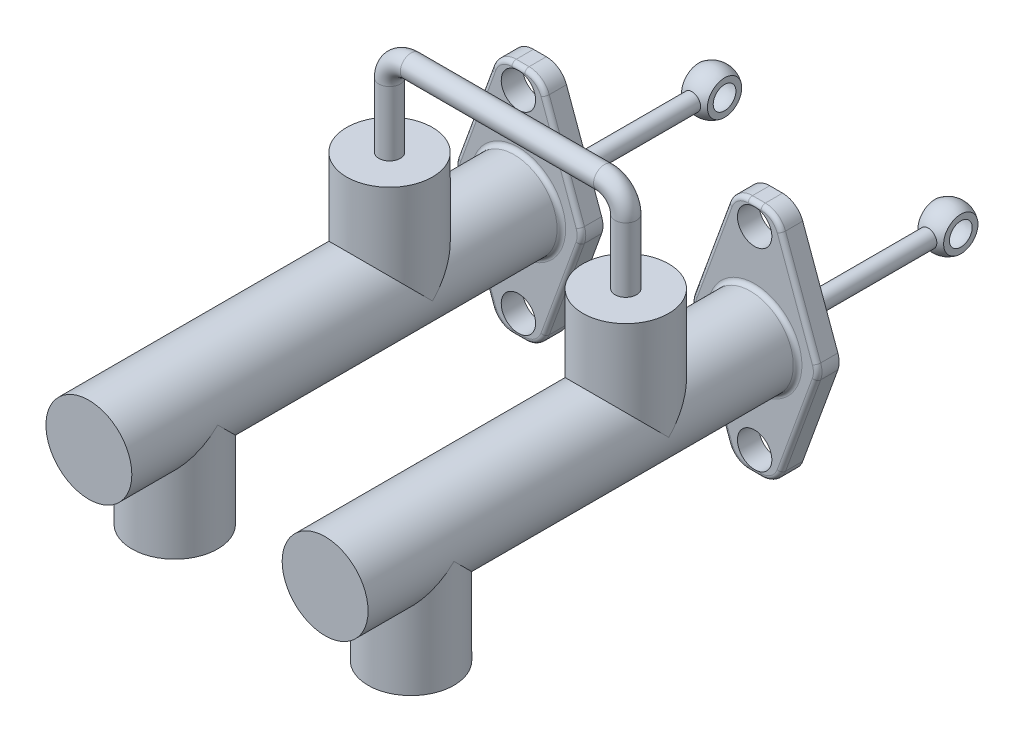
from build123d import *

# Parameters (mm, degrees)
SZKIC1_R                          = 10
DODANIE_WYCI_GNI_CIE1_DEPTH       = 50
DODANIE_WYCI_GNI_CIE1_2_DEPTH     = 50
SZKIC2_R                          = 4
DODANIE_WYCI_GNI_CIE2_DEPTH       = 5
ZAOKR_GLENIE1_R                   = 5
ZAOKR_GLENIE2_R                   = 5
ZAOKR_GLENIE3_R                   = 1
ZAOKR_GLENIE4_R                   = 1
SZKIC5_W                          = 12
SZKIC5_H                          = 25
SZKIC5_W_2                        = 6
SZKIC5_H_2                        = 20
WYTNIJ_WYCI_GNI_CIE1_DEPTH        = 50
SZKIC6_R                          = 10
DODANIE_WYCI_GNI_CIE3_DEPTH       = 25
WYCI_GNI_CIE_PO_CIE_CE1_PROFILE_R = 2.5
SZKIC19_R                         = 10
SZKIC19_R_2                       = 6
DODANIE_WYCI_GNI_CIE4_DEPTH       = 25


with BuildPart() as part:
    # Szkic1 → Dodanie-wyciągnięcie1 (new, symmetric)
    with BuildSketch(Plane.XY):
        with Locations((-27.5, 0)):
            Circle(SZKIC1_R)
    extrude(amount=DODANIE_WYCI_GNI_CIE1_DEPTH, both=True)



with BuildPart() as body_2:
    # Szkic1 → Dodanie-wyci_gni_cie1 2 (new, symmetric)
    with BuildSketch(Plane.XY):
        with Locations((27.5, 0)):
            Circle(SZKIC1_R)
    extrude(amount=DODANIE_WYCI_GNI_CIE1_2_DEPTH, both=True)


with BuildPart() as part_1:
    add(part.part)

    add(body_2.part)  # Dodanie-wyciągnięcie2 merges body 2
    # Szkic2 → Dodanie-wyciągnięcie2 (add)
    # profile 1 of 2: a face of its own
    with BuildSketch(Plane(origin=(0, 0, -50), x_dir=(-1, 0, 0), z_dir=(0, 0, -1))):
        Polygon((-22.5, 27.5), (-32.5, 27.5), (-42.5, 0), (-32.5, -27.5), (-22.5, -27.5), (-12.5, 0), align=None)
        with Locations((-27.5, 22.5)):
            Circle(SZKIC2_R, mode=Mode.SUBTRACT)
        with Locations((-27.5, -22.5)):
            Circle(SZKIC2_R, mode=Mode.SUBTRACT)
    # profile 2 of 2: a face of its own
    with BuildSketch(Plane(origin=(0, 0, -50), x_dir=(-1, 0, 0), z_dir=(0, 0, -1))):
        Polygon((12.5, 0), (22.5, 27.5), (32.5, 27.5), (42.5, 0), (32.5, -27.5), (22.5, -27.5), align=None)
        with Locations(Location((27.5, -22.5, 0), (0, 0, 180))):
            Circle(SZKIC2_R, mode=Mode.SUBTRACT)
        with Locations(Location((27.5, 22.5, 0), (0, 0, 180))):
            Circle(SZKIC2_R, mode=Mode.SUBTRACT)
    extrude(amount=DODANIE_WYCI_GNI_CIE2_DEPTH)

    # Zaokrąglenie1
    zaokr_glenie1_edges = [part_1.edges().sort_by_distance(p)[0] for p in [
        (-22.5, 27.5, -52.5),
        (-12.5, 0, -52.5),
        (-22.5, -27.5, -52.5),
        (-32.5, -27.5, -52.5),
        (-42.5, 0, -52.5),
        (-32.5, 27.5, -52.5),
    ]]
    fillet(zaokr_glenie1_edges, radius=ZAOKR_GLENIE1_R)

    # Zaokrąglenie2
    zaokr_glenie2_edges = [part_1.edges().sort_by_distance(p)[0] for p in [
        (22.5, -27.5, -52.5),
        (12.5, 0, -52.5),
        (22.5, 27.5, -52.5),
        (32.5, 27.5, -52.5),
        (42.5, 0, -52.5),
        (32.5, -27.5, -52.5),
    ]]
    fillet(zaokr_glenie2_edges, radius=ZAOKR_GLENIE2_R)

    # Zaokrąglenie3
    zaokr_glenie3_edges = [part_1.edges().sort_by_distance(p)[0] for p in [
        (-17.212260115, 12.958715315, -50),
        (-17.212260115, -12.958715315, -50),
        (-27.5, 27.5, -50),
        (-37.787739885, 12.958715315, -50),
        (-37.787739885, -12.958715315, -50),
        (-27.5, -27.5, -50),
        (-31.866349638, 26.595337384, -50),
        (-42.179681859, 0, -50),
        (-31.866349638, -26.595337384, -50),
        (-23.133650362, -26.595337384, -50),
        (-12.820318141, 0, -50),
        (-23.133650362, 26.595337384, -50),
        (-37.5, 0, -50),
    ]]
    fillet(zaokr_glenie3_edges, radius=ZAOKR_GLENIE3_R - 0.0001)  # a hair under: the kernel refuses the full size

    # Zaokrąglenie4
    zaokr_glenie4_edges = [part_1.edges().sort_by_distance(p)[0] for p in [
        (17.212260115, 12.958715315, -50),
        (17.212260115, -12.958715315, -50),
        (27.5, -27.5, -50),
        (37.787739885, -12.958715315, -50),
        (37.787739885, 12.958715315, -50),
        (27.5, 27.5, -50),
        (23.133650362, 26.595337384, -50),
        (31.866349638, 26.595337384, -50),
        (42.179681859, 0, -50),
        (31.866349638, -26.595337384, -50),
        (23.133650362, -26.595337384, -50),
        (12.820318141, 0, -50),
        (17.5, 0, -50),
    ]]
    fillet(zaokr_glenie4_edges, radius=ZAOKR_GLENIE4_R - 0.0001)  # a hair under: the kernel refuses the full size

    # Szkic3 → Obrót1 (revolve)
    with BuildSketch(Plane(origin=(0, 0, 0), x_dir=(1, 0, 0), z_dir=(0, 1, 0))):
        with BuildLine():
            Line((27.5, 55), (29.5, 55))
            Line((29.5, 55), (29.5, 90.417424305))
            ThreePointArc((29.5, 90.417424305), (32.394531565, 96.021548218), (27.5, 100))
            Line((27.5, 100), (27.5, 99))
            ThreePointArc((27.5, 99), (31.5, 95), (27.5, 91))
            Line((27.5, 91), (27.5, 55))
        make_face()
    revolve(axis=Axis((27.5, 0, 50), (0, 0, -1)))

    # Szkic4 → Obrót2 (revolve)
    with BuildSketch(Plane(origin=(0, 0, 0), x_dir=(1, 0, 0), z_dir=(0, 1, 0)), mode=Mode.PRIVATE) as obr_t2_sk:
        with BuildLine():
            Line((-27.5, 55), (-29.5, 55))
            Line((-29.5, 55), (-29.5, 90.417424305))
            ThreePointArc((-29.5, 90.417424305), (-32.394531565, 96.021548218), (-27.5, 100))
            Line((-27.5, 100), (-27.5, 99))
            ThreePointArc((-27.5, 99), (-31.5, 95), (-27.5, 91))
            Line((-27.5, 91), (-27.5, 55))
        make_face()
    revolve(obr_t2_sk.sketch.rotate(Axis((-27.5, 0, 50), (0, 0, -1)), 180), axis=Axis((-27.5, 0, 50), (0, 0, -1)))

    # Szkic5 → Wytnij-wyciągnięcie1 (cut)
    # profile 1 of 2: a face of its own
    with BuildSketch(Plane(origin=(0, 0, -55), x_dir=(-1, 0, 0), z_dir=(0, 0, -1))):
        with Locations((-27.5, 0)):
            Rectangle(SZKIC5_W, SZKIC5_H)
        with Locations((-27.5, 0)):
            Rectangle(SZKIC5_W_2, SZKIC5_H_2, mode=Mode.SUBTRACT)
    # profile 2 of 2: a face of its own
    with BuildSketch(Plane(origin=(0, 0, -55), x_dir=(-1, 0, 0), z_dir=(0, 0, -1))):
        with Locations((27.5, 0)):
            Rectangle(SZKIC5_W, SZKIC5_H)
        with Locations((27.5, 0)):
            Rectangle(SZKIC5_W_2, SZKIC5_H_2, mode=Mode.SUBTRACT)
    extrude(amount=WYTNIJ_WYCI_GNI_CIE1_DEPTH, mode=Mode.SUBTRACT)

    # Szkic6 → Dodanie-wyciągnięcie3 (add)
    with BuildSketch(Plane(origin=(0, 0, 0), x_dir=(1, 0, 0), z_dir=(0, 1, 0))):
        with Locations((-27.5, 20)):
            Circle(SZKIC6_R)
        with Locations((27.5, 20)):
            Circle(SZKIC6_R)
    extrude(amount=DODANIE_WYCI_GNI_CIE3_DEPTH)

    # Wyciągnięcie po ścieżce1: sweep along a path in Szkic7
    with BuildLine(Plane.XY.offset(-20)) as wyci_gni_cie_po_cie_ce1_path:
        Line((-27.5, 25), (-27.5, 40))
        ThreePointArc((-27.5, 40), (-26.035533906, 43.535533906), (-22.5, 45))
        Line((-22.5, 45), (22.5, 45))
        ThreePointArc((22.5, 45), (26.035533906, 43.535533906), (27.5, 40))
        Line((27.5, 40), (27.5, 25))
    # Wyciągnięcie po ścieżce1 profile (on start of the path) → Wyciągnięcie po ścieżce1 (sweep)
    with BuildSketch(Plane(origin=(-27.5, 25, -20), x_dir=(1, 0, 0), z_dir=(0, 1, 0))):
        Circle(WYCI_GNI_CIE_PO_CIE_CE1_PROFILE_R)
    sweep(path=wyci_gni_cie_po_cie_ce1_path.line)

    # Szkic19 → Dodanie-wyciągnięcie4 (add)
    # profile 1 of 2: a face of its own
    with BuildSketch(Plane(origin=(0, 0, 0), x_dir=(1, 0, 0), z_dir=(0, 1, 0))):
        with Locations(Location((27.5, -30, 0), (0, 0, 270))):
            Circle(SZKIC19_R)
        with Locations(Location((27.5, -30, 0), (0, 0, 270))):
            Circle(SZKIC19_R_2, mode=Mode.SUBTRACT)
    # profile 2 of 2: a face of its own
    with BuildSketch(Plane(origin=(0, 0, 0), x_dir=(1, 0, 0), z_dir=(0, 1, 0))):
        with Locations(Location((-27.5, -30, 0), (0, 0, 270))):
            Circle(SZKIC19_R)
        with Locations(Location((-27.5, -30, 0), (0, 0, 270))):
            Circle(SZKIC19_R_2, mode=Mode.SUBTRACT)
    extrude(amount=-DODANIE_WYCI_GNI_CIE4_DEPTH)


solid = part_1.part
